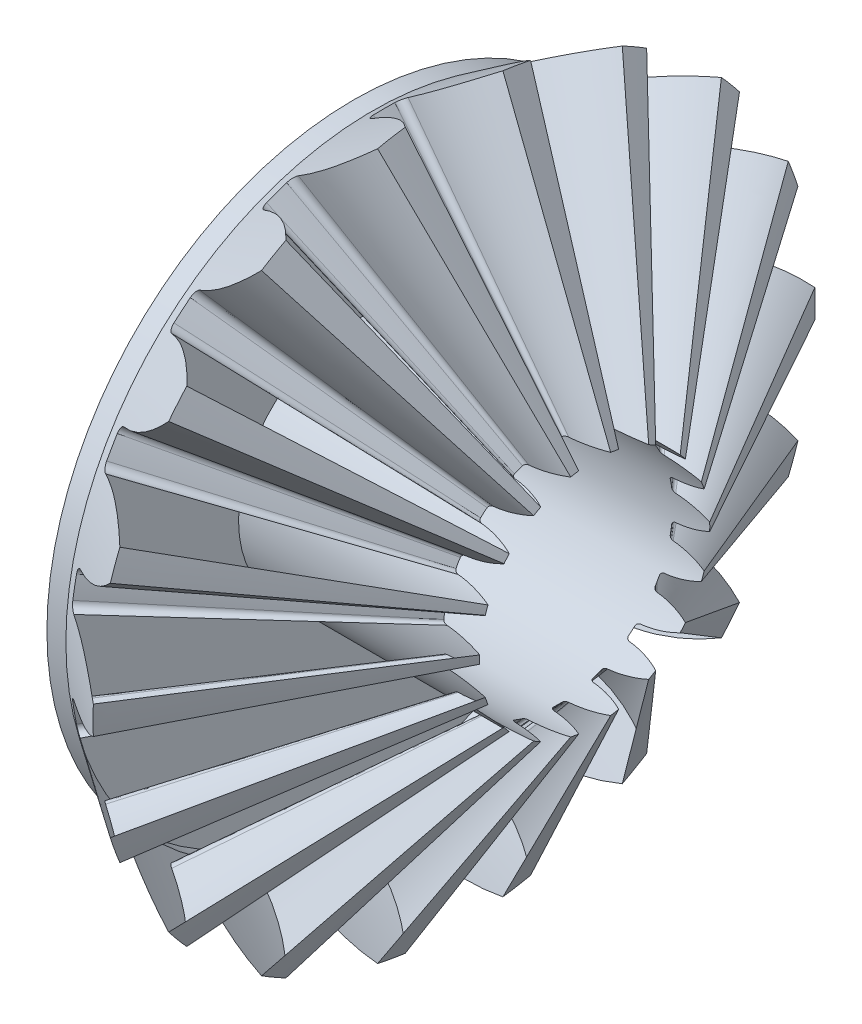
from build123d import *

# Parameters (mm, degrees)
TEETHCUTS_COUNT = 18
TEETHCUTS_ANGLE = 340
HUBSKE_R        = 1.999075203
HUB_DEPTH       = 0.123714404
BORSKE_R        = 0.75
BORE_DEPTH      = 2.0000508


with BuildPart() as part:
    # BasProSke → Base-Revolve (revolve)
    with BuildSketch(Plane(origin=(0, 0, 0), x_dir=(1, 0, 0), z_dir=(0, 1, 0)), mode=Mode.PRIVATE) as base_revolve_sk:
        Polygon((0, 0), (0, 1.999075203), (0.531241001, 2.35323587), (1.741872574, 0.235323585), (1.688748474, 0.199907519), (1.688748474, 0), align=None)
    revolve(base_revolve_sk.sketch.rotate(Axis((-10, 0, 0), (1, 0, 0)), 180), axis=Axis((-10, 0, 0), (1, 0, 0)))

    # ToothCut: read off the stored shape, not the designer's step
    # ToothCut: loft between two sections, ruled curve by curve
    toothcut_from = [
        Edge.make_bspline([(1.884000029, 0.005075222, -0.008807771), (1.879064897, 0.001785134, -0.01496918), (1.871966961, -0.002946823, -0.014360047), (1.867810317, -0.005717919, -0.007418397)], [0, 0, 0, 0, 1, 1, 1, 1], 3, [1, 0.760301363, 0.760301363, 1]),
        Edge.make_bspline([(1.867810317, -0.005717919, 0.007418397), (1.871966961, -0.002946823, 0.014360047), (1.879064897, 0.001785134, 0.01496918), (1.884000029, 0.005075222, 0.008807771)], [0, 0, 0, 0, 1, 1, 1, 1], 3, [1, 0.760301363, 0.760301363, 1]),
        Edge.make_bspline([(1.867810317, -0.005717919, -0.007418397), (1.867183913, -0.006135522, -0.006372293), (1.866696181, -0.006460677, -0.005224468), (1.866358317, -0.006685919, -0.004001267)], [0, 0, 0, 0, 1, 1, 1, 1], 3, [1, 0.992349666, 0.992349666, 1]),
        Edge.make_bspline([(1.866358317, -0.006685919, 0.004001267), (1.866696181, -0.006460677, 0.005224468), (1.867183913, -0.006135522, 0.006372293), (1.867810317, -0.005717919, 0.007418397)], [0, 0, 0, 0, 1, 1, 1, 1], 3, [1, 0.992349666, 0.992349666, 1]),
        Edge.make_bspline([(1.866358317, -0.006685919, -0.004001267), (1.865634463, -0.007168489, -0.001380631), (1.865634463, -0.007168489, 0.001380631), (1.866358317, -0.006685919, 0.004001267)], [0, 0, 0, 0, 1, 1, 1, 1], 3, [1, 0.966047751, 0.966047751, 1]),
        Edge.make_line((1.884000029, 0.005075222, 0.008807771), (1.884000029, 0.005075222, -0.008807771)),
    ]
    toothcut_to = [
        Edge.make_bspline([(0.551141844, 2.366503098, -0.350220318), (0.428339706, 2.284635007, -0.215907658), (0.276172208, 2.183190008, -0.136054012), (0.110731519, 2.072896216, -0.119104143)], [0, 0, 0, 0, 1, 1, 1, 1], 3, [1, 0.964748998, 0.964748998, 1]),
        Edge.make_bspline([(0.110731519, 2.072896216, 0.119104143), (0.276172208, 2.183190008, 0.136054012), (0.428339706, 2.284635007, 0.215907658), (0.551141844, 2.366503098, 0.350220318)], [0, 0, 0, 0, 1, 1, 1, 1], 3, [1, 0.964748998, 0.964748998, 1]),
        Edge.make_bspline([(0.110731519, 2.072896216, -0.119104143), (0.088302301, 2.057943404, -0.116806206), (0.07338374, 2.047997697, -0.096546484), (0.074212463, 2.048550178, -0.069510491)], [0, 0, 0, 0, 1, 1, 1, 1], 3, [1, 0.815964661, 0.815964661, 1]),
        Edge.make_bspline([(0.074212463, 2.048550178, 0.069510491), (0.07338374, 2.047997697, 0.096546484), (0.088302301, 2.057943404, 0.116806206), (0.110731519, 2.072896216, 0.119104143)], [0, 0, 0, 0, 1, 1, 1, 1], 3, [1, 0.815964661, 0.815964661, 1]),
        Edge.make_bspline([(0.074212463, 2.048550178, -0.069510491), (0.075632592, 2.049496931, -0.02318064), (0.075632592, 2.049496931, 0.02318064), (0.074212463, 2.048550178, 0.069510491)], [0, 0, 0, 0, 1, 1, 1, 1], 3, [1, 0.99954807, 0.99954807, 1]),
        Edge.make_line((0.551141844, 2.366503098, 0.350220318), (0.551141844, 2.366503098, -0.350220318)),
    ]
    toothcut = Solid(Shell([*[Face.make_surface_from_curves(toothcut_from[k], toothcut_to[k]) for k in range(6)], Face(Wire(toothcut_from)), Face(Wire(toothcut_to))]))
    add(toothcut, mode=Mode.SUBTRACT)

    # TeethCuts: ToothCut ×18 about axis
    teethcuts_axis = Axis((-10, 0, 0), (1, 0, 0))
    for i in range(1, TEETHCUTS_COUNT):
        add(toothcut.rotate(teethcuts_axis, i * TEETHCUTS_ANGLE / (TEETHCUTS_COUNT - 1)), mode=Mode.SUBTRACT)

    # HubSke → Hub (add)
    with BuildSketch(Plane.ZY):
        Circle(HUBSKE_R)
    extrude(amount=HUB_DEPTH)

    # BorSke → Bore (cut, symmetric)
    with BuildSketch(Plane(origin=(0, 0, 0), x_dir=(0, 0, -1), z_dir=(1, 0, 0))):
        with Locations(Location((0, 0, 0), (0, 0, 180))):
            Circle(BORSKE_R)
    extrude(amount=BORE_DEPTH, both=True, mode=Mode.SUBTRACT)


solid = part.part
